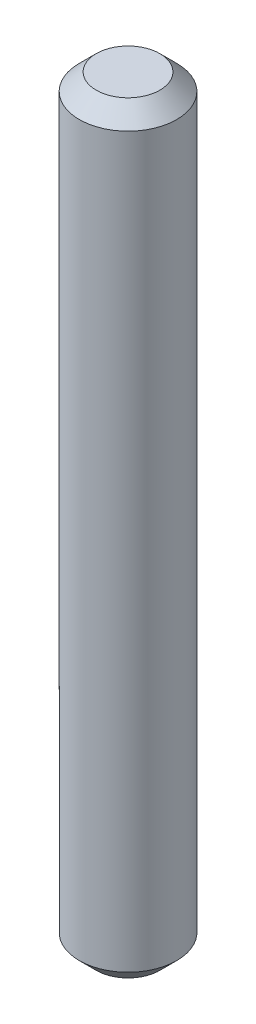
from build123d import *

# Parameters (mm, degrees)
SKETCH1_R           = 2.875
BOSS_EXTRUDE1_DEPTH = 22.5
CHAMFER1_SIZE       = 1


with BuildPart() as part:
    # Sketch1 → Boss-Extrude1 (new, symmetric)
    with BuildSketch(Plane(origin=(0, 0, 0), x_dir=(1, 0, 0), z_dir=(0, 1, 0))):
        Circle(SKETCH1_R)
    extrude(amount=BOSS_EXTRUDE1_DEPTH, both=True)

    # Chamfer1
    chamfer1_edges = [part.edges().sort_by_distance(p)[0] for p in [
        (-2.875, 22.5, 0),
        (-2.875, -22.5, 0),
    ]]
    chamfer(chamfer1_edges, length=CHAMFER1_SIZE)


solid = part.part
